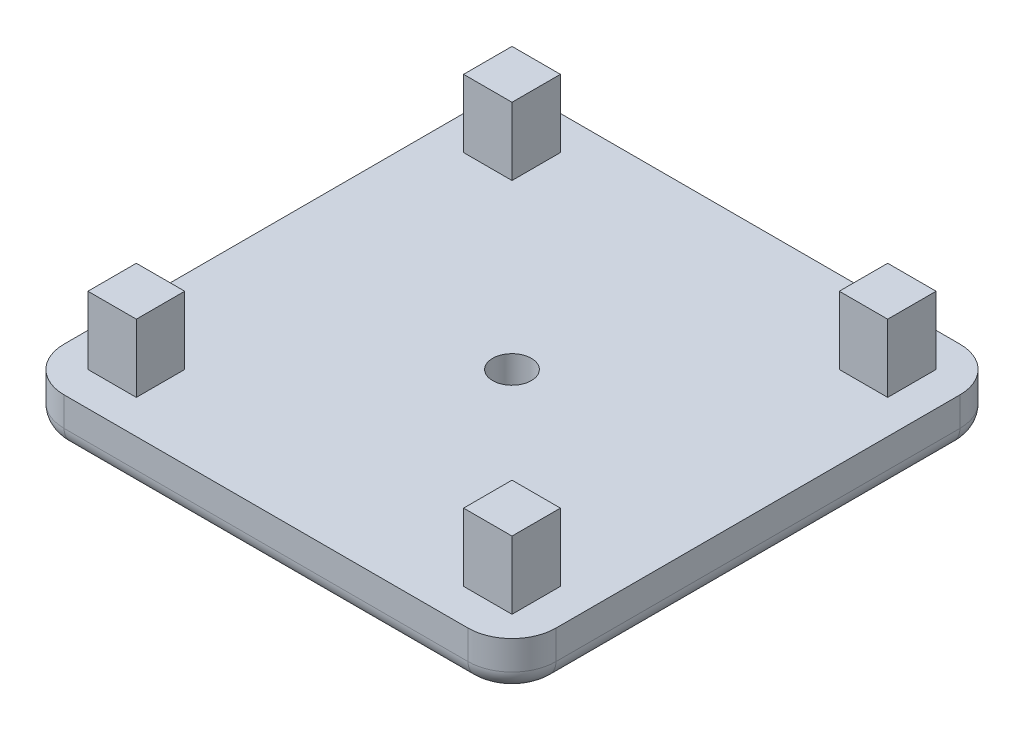
from build123d import *

# Parameters (mm, degrees)
SKETCH1_W           = 50.8
SKETCH1_H           = 50.8
SKETCH1_R           = 2
SKETCH1_W_2         = 5
SKETCH1_H_2         = 5
BOSS_EXTRUDE1_DEPTH = 5
FILLET1_R           = 2
FILLET2_R           = 4.54
SKETCH1_6_W         = 5
SKETCH1_6_H         = 5
BOSS_EXTRUDE2_DEPTH = 12


with BuildPart() as part:
    # Sketch1 → Boss-Extrude1 (new body)
    with BuildSketch(Plane(origin=(0, 0, 0), x_dir=(1, 0, 0), z_dir=(0, 1, 0))):
        Rectangle(SKETCH1_W, SKETCH1_H)
        with Locations(Location((0, 0, 0), (0, 0, 270))):
            Circle(SKETCH1_R, mode=Mode.SUBTRACT)
        with Locations((-19.4, 19.4)):
            Rectangle(SKETCH1_W_2, SKETCH1_H_2, mode=Mode.SUBTRACT)
        with Locations((19.4, 19.4)):
            Rectangle(SKETCH1_W_2, SKETCH1_H_2, mode=Mode.SUBTRACT)
        with Locations((-19.4, -19.4)):
            Rectangle(SKETCH1_W_2, SKETCH1_H_2, mode=Mode.SUBTRACT)
        with Locations((19.4, -19.4)):
            Rectangle(SKETCH1_W_2, SKETCH1_H_2, mode=Mode.SUBTRACT)
    extrude(amount=BOSS_EXTRUDE1_DEPTH)

    # Fillet1
    fillet1_edges = [part.edges().sort_by_distance(p)[0] for p in [
        (0, 0, 25.4),
        (-25.4, 0, 0),
        (0, 0, -25.4),
        (25.4, 0, 0),
    ]]
    fillet(fillet1_edges, radius=FILLET1_R)

    # Fillet2
    # the kernel refuses this fillet: 4.54 mm, written as the material it takes off along each edge
    with BuildSketch(Plane(origin=(20.86, 0, -20.86), x_dir=(0, 0, -1), z_dir=(-1, 0, 0))) as fillet2_piece_1:
        with BuildLine():
            CenterArc((2.54, -2), 2, 0, 90)
            Line((4.54, -2), (4.54, 0))
            Line((4.54, 0), (2.54, 0))
        make_face()
    revolve(axis=Axis((20.86, 0, -20.86), (0, -1, 0)), revolution_arc=90, mode=Mode.SUBTRACT)
    with BuildSketch(Plane(origin=(20.86, 0, 20.86), x_dir=(1, 0, 0), z_dir=(0, 0, -1))) as fillet2_piece_2:
        with BuildLine():
            CenterArc((2.54, -2), 2, 0, 90)
            Line((4.54, -2), (4.54, 0))
            Line((4.54, 0), (2.54, 0))
        make_face()
    revolve(axis=Axis((20.86, 0, 20.86), (0, -1, 0)), revolution_arc=90, mode=Mode.SUBTRACT)
    with BuildSketch(Plane(origin=(-20.86, 0, -20.86), x_dir=(-1, 0, 0), z_dir=(0, 0, 1))) as fillet2_piece_3:
        with BuildLine():
            CenterArc((2.54, -2), 2, 0, 90)
            Line((4.54, -2), (4.54, 0))
            Line((4.54, 0), (2.54, 0))
        make_face()
    revolve(axis=Axis((-20.86, 0, -20.86), (0, -1, 0)), revolution_arc=90, mode=Mode.SUBTRACT)
    with BuildSketch(Plane(origin=(-20.86, 0, 20.86), x_dir=(0, 0, 1), z_dir=(1, 0, 0))) as fillet2_piece_4:
        with BuildLine():
            CenterArc((2.54, -2), 2, 0, 90)
            Line((4.54, -2), (4.54, 0))
            Line((4.54, 0), (2.54, 0))
        make_face()
    revolve(axis=Axis((-20.86, 0, 20.86), (0, -1, 0)), revolution_arc=90, mode=Mode.SUBTRACT)
    with BuildSketch(Plane(origin=(25.4, 0, 25.4), x_dir=(0, 0, -1), z_dir=(0, 1, 0)), Plane(origin=(25.4, 0, -25.4), x_dir=(-1, 0, 0), z_dir=(0, 1, 0))) as fillet2_piece_5:
        with BuildLine():
            CenterArc((FILLET2_R, FILLET2_R), FILLET2_R, 180, 90)
            Line((0, FILLET2_R), (0, 0))
            Line((0, 0), (FILLET2_R, 0))
        make_face()
    extrude(amount=16.35, mode=Mode.SUBTRACT)
    with BuildSketch(Plane(origin=(-25.4, 0, 25.4), x_dir=(0, 0, -1), z_dir=(0, 1, 0)), Plane(origin=(-25.4, 0, -25.4), x_dir=(1, 0, 0), z_dir=(0, 1, 0))) as fillet2_piece_6:
        with BuildLine():
            CenterArc((FILLET2_R, -FILLET2_R), FILLET2_R, 90, 90)
            Line((0, -FILLET2_R), (0, 0))
            Line((0, 0), (FILLET2_R, 0))
        make_face()
    extrude(amount=16.35, mode=Mode.SUBTRACT)

    # Sketch1<6> → Boss-Extrude2 (add)
    with BuildSketch(Plane(origin=(0, 0, 0), x_dir=(1, 0, 0), z_dir=(0, 1, 0))):
        with Locations((-19.4, -19.4)):
            Rectangle(SKETCH1_6_W, SKETCH1_6_H)
        with Locations((19.4, -19.4)):
            Rectangle(SKETCH1_6_W, SKETCH1_6_H)
        with Locations((19.4, 19.4)):
            Rectangle(SKETCH1_6_W, SKETCH1_6_H)
        with Locations((-19.4, 19.4)):
            Rectangle(SKETCH1_6_W, SKETCH1_6_H)
    extrude(amount=BOSS_EXTRUDE2_DEPTH)


solid = part.part
